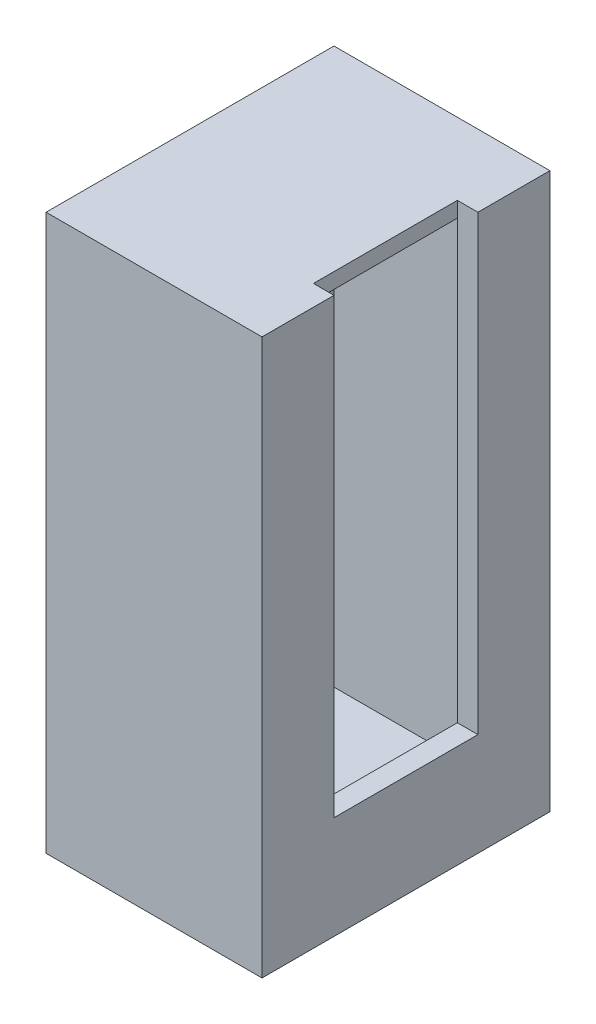
from build123d import *

# Parameters (mm, degrees)
SALIENTE_EXTRUIR1_DEPTH = 177.8
CROQUIS2_W              = 177.8
CROQUIS2_H              = 558.8
CORTAR_EXTRUIR1_DEPTH   = 25.4
VACIADO1_START          = -323.85
VACIADO1_DEPTH          = 647.7
VACIADO1_2_OUTLINE_W    = 6.35
VACIADO1_2_OUTLINE_H    = 215.9
VACIADO1_2_DEPTH        = 88.9


# Read off the part's stored shape, not the designer's step: Vaciado1
with BuildPart() as part:
    # Croquis1 → Saliente-Extruir1 (new, symmetric)
    with BuildSketch(Plane.XY):
        Polygon((-133.35, 342.9), (-133.35, -342.9), (133.35, -342.9), (133.35, 0), (133.35, 342.9), align=None)
    extrude(amount=SALIENTE_EXTRUIR1_DEPTH, both=True)

    # Croquis2 → Cortar-Extruir1 (cut)
    with BuildSketch(Plane(origin=(133.35, 0, 0), x_dir=(0, 0, -1), z_dir=(1, 0, 0))):
        with Locations((0, 63.5)):
            Rectangle(CROQUIS2_W, CROQUIS2_H)
    extrude(amount=-CORTAR_EXTRUIR1_DEPTH, mode=Mode.SUBTRACT)

    # Vaciado1 outline → Vaciado1 (cut)
    with BuildSketch(Plane(origin=(0, 0, 0), x_dir=(1, 0, 0), z_dir=(0, 1, 0)).offset(VACIADO1_START)):
        Polygon((-114.3, 158.75), (-114.3, -158.75), (114.3, -158.75), (114.3, -107.95), (107.95, -107.95), (107.95, 107.95), (114.3, 107.95), (114.3, 158.75), align=None)
    extrude(amount=VACIADO1_DEPTH, mode=Mode.SUBTRACT)

    # Vaciado1 2 outline → Vaciado1 2 (cut)
    with BuildSketch(Plane(origin=(0, 0, 0), x_dir=(1, 0, 0), z_dir=(0, 1, 0)).offset(VACIADO1_START)):
        with Locations((111.125, 0)):
            Rectangle(VACIADO1_2_OUTLINE_W, VACIADO1_2_OUTLINE_H)
    extrude(amount=VACIADO1_2_DEPTH, mode=Mode.SUBTRACT)


solid = part.part
